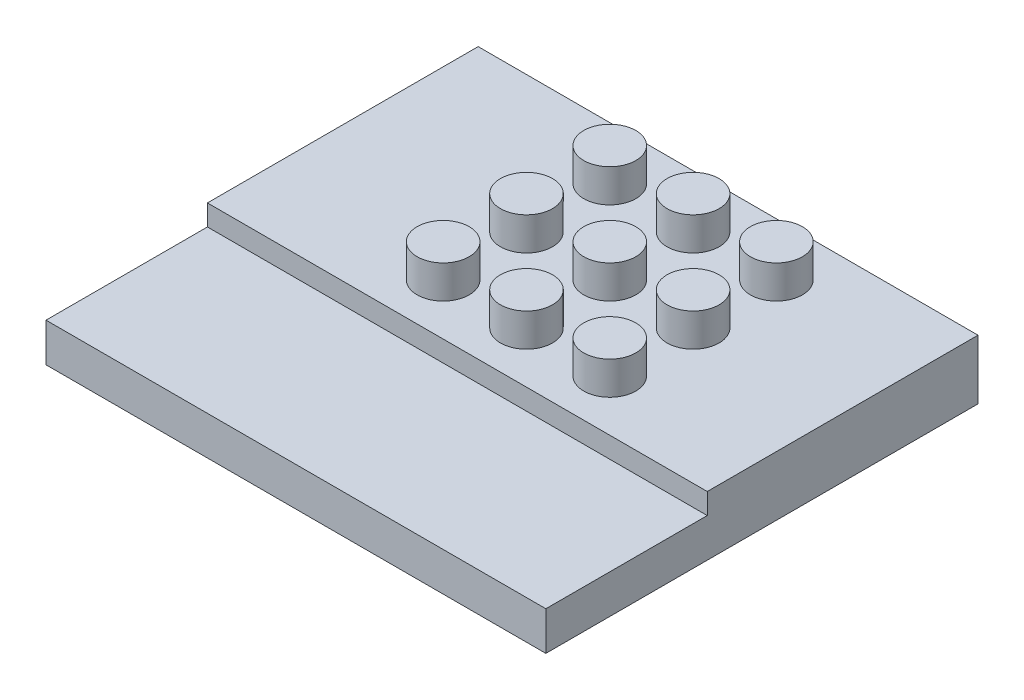
from build123d import *

# Parameters (mm, degrees)
SKETCH3_W                = 6.75
SKETCH3_H                = 10.25
BOSS_EXTRUDE2_DEPTH      = 4.4125
BOSS_EXTRUDE3_DEPTH      = 1.5875
BOSS_EXTRUDE3_DEPTH_BACK = 6
SKETCH5_R                = 1.25
SKETCH6_W                = 20.75
SKETCH6_H                = 2.8575
BOSS_EXTRUDE4_DEPTH      = 6
SKETCH7_W                = 20.75
SKETCH7_H                = 2.8575
BOSS_EXTRUDE5_DEPTH      = 11.25
BOSS_EXTRUDE6_REACH      = 35.732
SKETCH9_W                = 9.25
SKETCH9_H                = 2.8575
BOSS_EXTRUDE7_REACH      = 35.732
SKETCH10_W               = 1.25
SKETCH10_H               = 2.8575
SKETCH11_W               = 4.903668723
SKETCH11_H               = 13.795083936
CUT_EXTRUDE1_DEPTH       = 3.1425
SKETCH12_W               = 24.809843128
SKETCH12_H               = 8.769619276
SKETCH12_W_2             = 24.763261225
SKETCH12_H_2             = 4.320789845
CUT_EXTRUDE2_DEPTH       = 1


with BuildPart() as part:
    # Sketch3 → Boss-Extrude2 (new body)
    with BuildSketch(Plane(origin=(0, 1.5875, 0), x_dir=(-1, 0, 0), z_dir=(0, 1, 0))):
        with Locations((-14.125, -21.125)):
            Rectangle(SKETCH3_W, SKETCH3_H)
    extrude(amount=BOSS_EXTRUDE2_DEPTH)

    # Sketch5 → Boss-Extrude3 (add, two sides: drawn at the far end of the back side and taken through both)
    with BuildSketch(Plane.XZ.offset(-1.5875).offset(-BOSS_EXTRUDE3_DEPTH_BACK)):
        with Locations((16.36, -24.96)):
            Circle(SKETCH5_R)
        with Locations((12.36, -24.96)):
            Circle(SKETCH5_R)
        with Locations((8.36, -24.96)):
            Circle(SKETCH5_R)
        with Locations((16.36, -20.96)):
            Circle(SKETCH5_R)
        with Locations((12.36, -20.96)):
            Circle(SKETCH5_R)
        with Locations((8.36, -20.96)):
            Circle(SKETCH5_R)
        with Locations((16.36, -16.96)):
            Circle(SKETCH5_R)
        with Locations((12.36, -16.96)):
            Circle(SKETCH5_R)
        with Locations((8.36, -16.96)):
            Circle(SKETCH5_R)
    extrude(amount=BOSS_EXTRUDE3_DEPTH + BOSS_EXTRUDE3_DEPTH_BACK)


with BuildPart() as boss_extrude3_piece_1:
    # of the separate pieces the step leaves, piece 1, a body of its own (boss_extrude3_pieces)
    add(part.part.solids().sort_by_distance((10.75, 1.5875, -16))[0])

    # Sketch6 → Boss-Extrude4 (add)
    with BuildSketch(Plane(origin=(17.5, 0, 0), x_dir=(0, 0, -1), z_dir=(1, 0, 0))):
        with Locations((17.125, 4.57125)):
            Rectangle(SKETCH6_W, SKETCH6_H)
    extrude(amount=BOSS_EXTRUDE4_DEPTH)

    # Sketch7 → Boss-Extrude5 (add)
    with BuildSketch(Plane.ZY.offset(-10.75)):
        with Locations((-17.125, 4.57125)):
            Rectangle(SKETCH7_W, SKETCH7_H)
    extrude(amount=BOSS_EXTRUDE5_DEPTH)

    # Sketch9 → Boss-Extrude6 (add, up to next)
    with BuildSketch(Plane.ZY.offset(-17.5), mode=Mode.PRIVATE) as boss_extrude6_sk1:
        with Locations((-11.375, 4.57125)):
            Rectangle(SKETCH9_W, SKETCH9_H)
    boss_extrude6_tool1 = extrude(boss_extrude6_sk1.sketch, amount=BOSS_EXTRUDE6_REACH, mode=Mode.PRIVATE) - boss_extrude3_piece_1.part
    add(boss_extrude6_tool1.solids().sort_by_distance((17.5, 4.57125, -11.375))[0])

    # Sketch10 → Boss-Extrude7 (add, up to next)
    with BuildSketch(Plane.ZY.offset(-17.5), mode=Mode.PRIVATE) as boss_extrude7_sk1:
        with Locations((-26.875, 4.57125)):
            Rectangle(SKETCH10_W, SKETCH10_H)
    boss_extrude7_tool1 = extrude(boss_extrude7_sk1.sketch, amount=BOSS_EXTRUDE7_REACH, mode=Mode.PRIVATE) - boss_extrude3_piece_1.part
    add(boss_extrude7_tool1.solids().sort_by_distance((17.5, 4.57125, -26.875))[0])

    # Sketch12 → Cut-Extrude2 (cut)
    with BuildSketch(Plane(origin=(0, 6, 0), x_dir=(1, 0, 0), z_dir=(0, 1, 0))):
        with Locations((11.41674784, 10.115190362)):
            Rectangle(SKETCH12_W, SKETCH12_H)
        with Locations((11.435615265, 29.660394923)):
            Rectangle(SKETCH12_W_2, SKETCH12_H_2)
    extrude(amount=-CUT_EXTRUDE2_DEPTH, mode=Mode.SUBTRACT)


with BuildPart() as boss_extrude3_piece_2:
    # of the separate pieces the step leaves, piece 2, a body of its own (boss_extrude3_pieces)
    add(part.part.solids().sort_by_distance((9.61, 1.5875, -24.96))[0])


with BuildPart() as boss_extrude3_piece_3:
    # of the separate pieces the step leaves, piece 3, a body of its own (boss_extrude3_pieces)
    add(part.part.solids().sort_by_distance((9.61, 1.5875, -20.96))[0])


with BuildPart() as boss_extrude3_piece_4:
    # of the separate pieces the step leaves, piece 4, a body of its own (boss_extrude3_pieces)
    add(part.part.solids().sort_by_distance((9.61, 1.5875, -16.96))[0])


with BuildPart() as cut_extrude1_tool:
    # Sketch11 → Cut-Extrude1 (new body)
    with BuildSketch(Plane.XZ):
        with Locations((7.758670905, -20.928761162)):
            Rectangle(SKETCH11_W, SKETCH11_H)
    extrude(amount=-CUT_EXTRUDE1_DEPTH)


with BuildPart() as boss_extrude3_piece_2_1:
    add(boss_extrude3_piece_2.part)

    # Cut-Extrude1: cut by cut_extrude1_tool
    add(cut_extrude1_tool.part, mode=Mode.SUBTRACT)


with BuildPart() as boss_extrude3_piece_3_1:
    add(boss_extrude3_piece_3.part)

    # Cut-Extrude1: cut by cut_extrude1_tool
    add(cut_extrude1_tool.part, mode=Mode.SUBTRACT)


with BuildPart() as boss_extrude3_piece_4_1:
    add(boss_extrude3_piece_4.part)

    # Cut-Extrude1: cut by cut_extrude1_tool
    add(cut_extrude1_tool.part, mode=Mode.SUBTRACT)


solid = Compound([boss_extrude3_piece_1.part, boss_extrude3_piece_2_1.part, boss_extrude3_piece_3_1.part, boss_extrude3_piece_4_1.part])
